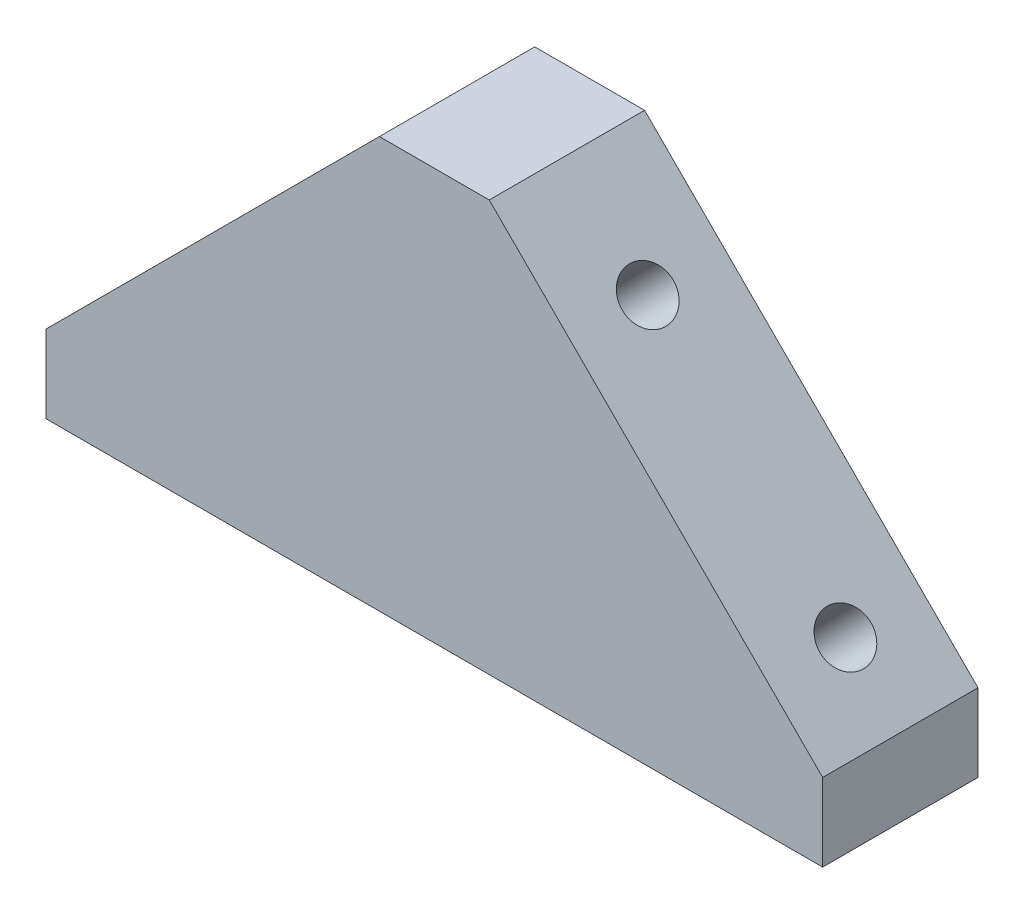
from build123d import *

# Parameters (mm, degrees)
BOSS_EXTRU_1_DEPTH      = 10
ESQUISSE2_R             = 1.65
ENL_V_MAT_EXTRU_1_DEPTH = 8
ESQUISSE3_R             = 1.65
ENL_V_MAT_EXTRU_2_DEPTH = 8
CHANFREIN1_SIZE         = 5


with BuildPart() as part:
    # Esquisse1 → Boss.-Extru.1 (new body)
    with BuildSketch(Plane.XY):
        Polygon((-25, 0), (25, 0), (25, 5), (0, 30), (-25, 5), align=None)
    extrude(amount=BOSS_EXTRU_1_DEPTH)

    # Esquisse2 → Enlèv. mat.-Extru.1 (cut)
    with BuildSketch(Plane(origin=(15, 15, 0), x_dir=(0, 0, -1), z_dir=(0.7071067811865511, 0.7071067811865439, 0))):
        with Locations((-5, 8.857864376)):
            Circle(ESQUISSE2_R)
        with Locations((-5, -9.142135624)):
            Circle(ESQUISSE2_R)
    extrude(amount=-ENL_V_MAT_EXTRU_1_DEPTH, mode=Mode.SUBTRACT)

    # Esquisse3 → Enlèv. mat.-Extru.2 (cut)
    with BuildSketch(Plane(origin=(-15, 15, 0), x_dir=(0, 0, 1), z_dir=(-0.7071067811865511, 0.7071067811865439, 0))):
        with Locations((5, 9.857864376)):
            Circle(ESQUISSE3_R)
        with Locations((5, -8.142135624)):
            Circle(ESQUISSE3_R)
    extrude(amount=-ENL_V_MAT_EXTRU_2_DEPTH, mode=Mode.SUBTRACT)

    # Chanfrein1
    chanfrein1_edges = [part.edges().sort_by_distance(p)[0] for p in [
        (0, 30, 5),
    ]]
    chamfer(chanfrein1_edges, length=CHANFREIN1_SIZE)


solid = part.part
